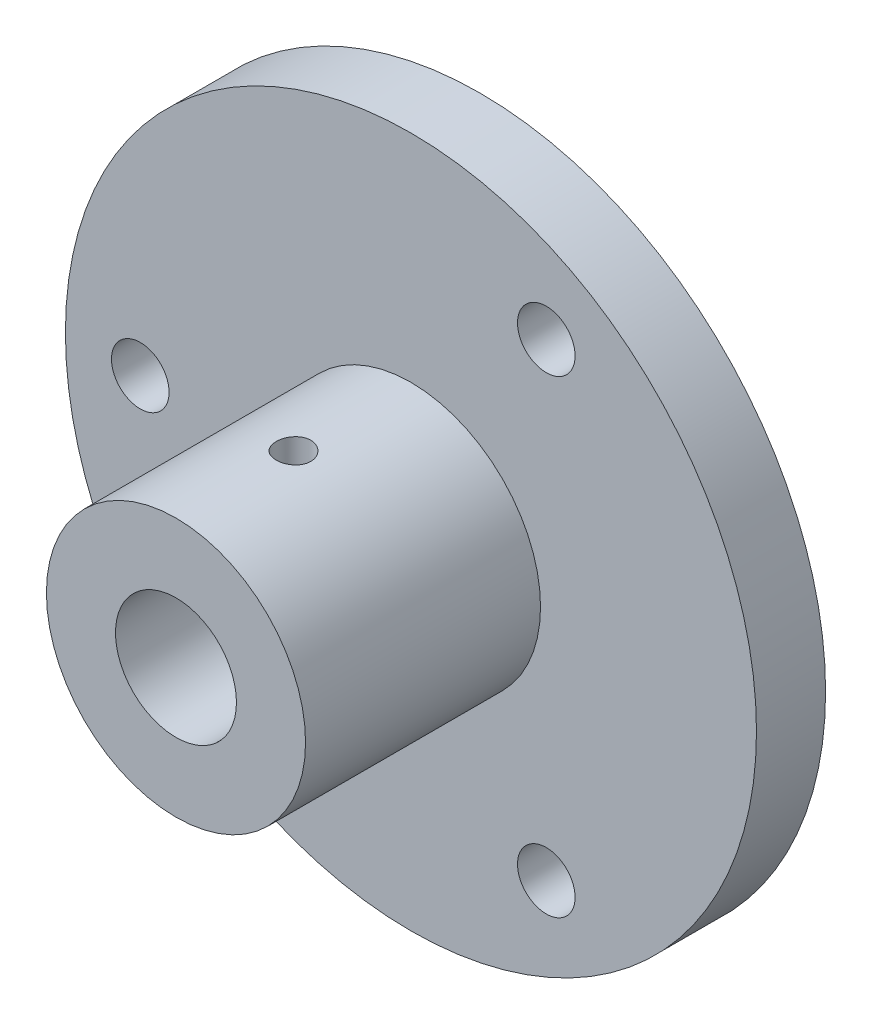
from build123d import *

# Parameters (mm, degrees)
SKETCH_1_R               = 30
SKETCH_1_R_2             = 2.5
SKETCH_1_R_3             = 5.25
EXTRUDE_1_DEPTH          = 6
SKETCH_3_R               = 11.25
SKETCH_3_R_2             = 5.25
EXTRUDE_2_DEPTH          = 20.4
CUT_EXTRUDE_1_DEPTH      = 50.969590753
CUT_EXTRUDE_1_DEPTH_BACK = 50.969590753
SKETCH_4_R               = 1.5


with BuildPart() as part:
    # ｽｹｯﾁ1 → ﾎﾞｽ - 押し出し1 (new body)
    with BuildSketch(Plane.XY):
        Circle(SKETCH_1_R)
        with Locations((-23.5, 0)):
            Circle(SKETCH_1_R_2, mode=Mode.SUBTRACT)
        with Locations((11.75, -20.351596989)):
            Circle(SKETCH_1_R_2, mode=Mode.SUBTRACT)
        with Locations((11.75, 20.351596989)):
            Circle(SKETCH_1_R_2, mode=Mode.SUBTRACT)
        Circle(SKETCH_1_R_3, mode=Mode.SUBTRACT)
    extrude(amount=EXTRUDE_1_DEPTH)

    # ｽｹｯﾁ3 → ﾎﾞｽ - 押し出し2 (add)
    with BuildSketch(Plane.XY.offset(6)):
        Circle(SKETCH_3_R)
        Circle(SKETCH_3_R_2, mode=Mode.SUBTRACT)
    extrude(amount=EXTRUDE_2_DEPTH)

    # ｽｹｯﾁ4 → ｶｯﾄ - 押し出し1 (cut, two sides: drawn at the far end of the back side and taken through both)
    with BuildSketch(Plane(origin=(0, 0, 0), x_dir=(1, 0, 0), z_dir=(0, 1, 0)).offset(-CUT_EXTRUDE_1_DEPTH_BACK)):
        with Locations((0, -16.2)):
            Circle(SKETCH_4_R)
    extrude(amount=CUT_EXTRUDE_1_DEPTH + CUT_EXTRUDE_1_DEPTH_BACK, mode=Mode.SUBTRACT)


solid = part.part
